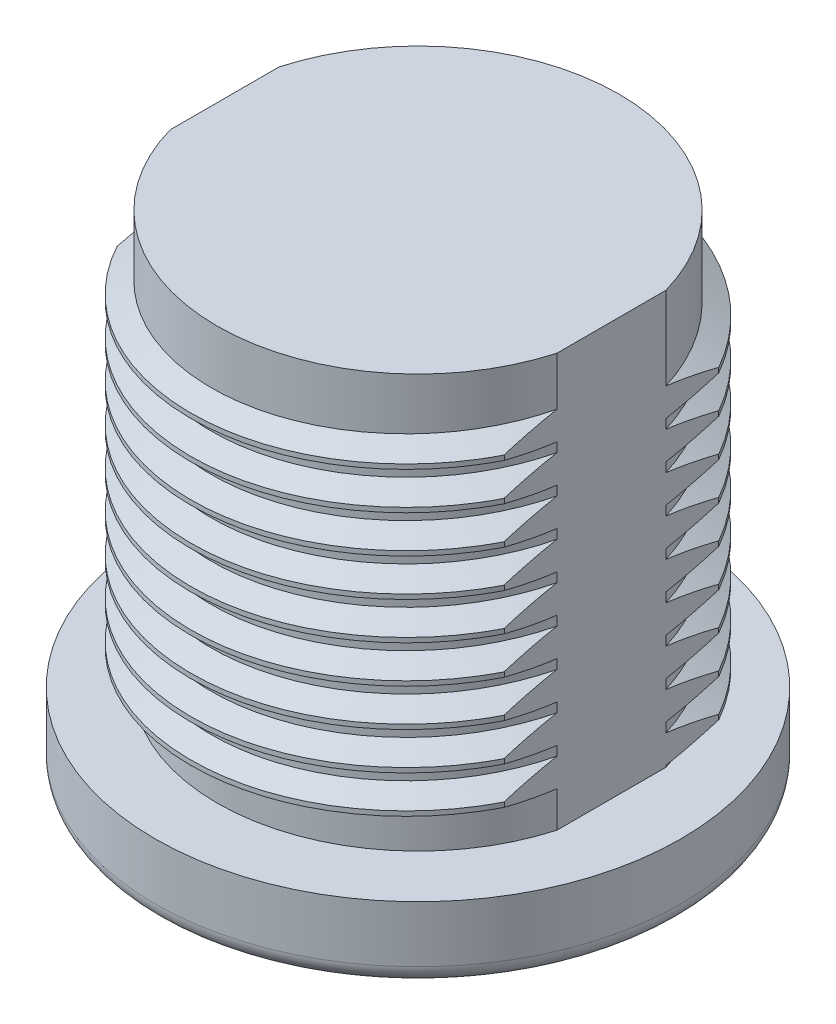
from build123d import *
from build123d.topology import SkipClean

# Parameters (mm, degrees)
CROQUIS1_R              = 7
SALIENTE_EXTRUIR1_DEPTH = 2
CROQUIS2_R              = 5.35
SALIENTE_EXTRUIR2_DEPTH = 11
ROSCA1_PITCH            = 1
CROQUIS6_W              = 1
CROQUIS6_H              = 5.7
CORTAR_EXTRUIR1_DEPTH   = 11
REDONDEO1_R             = 0.5
CROQUIS7_R              = 3.25
CORTAR_EXTRUIR2_DEPTH   = 8
CROQUIS8_R              = 0.5
SALIENTE_EXTRUIR3_DEPTH = 6
REDONDEO2_R             = 0.5


with BuildPart() as part:
    # Croquis1 → Saliente-Extruir1 (new body)
    with BuildSketch(Plane(origin=(0, 0, 0), x_dir=(1, 0, 0), z_dir=(0, 1, 0))):
        with Locations(Location((0, 0, 0), (0, 0, 270))):
            Circle(CROQUIS1_R)
    extrude(amount=SALIENTE_EXTRUIR1_DEPTH)

    # Croquis2 → Saliente-Extruir2 (add)
    with BuildSketch(Plane(origin=(0, 2, 0), x_dir=(1, 0, 0), z_dir=(0, 1, 0))):
        with Locations(Location((0, 0, 0), (0, 0, 270))):
            Circle(CROQUIS2_R)
    extrude(amount=SALIENTE_EXTRUIR2_DEPTH)

    # Rosca1: the profile of Perfil de rosca1 profile screwed along a right-hand helix of 9 turns, 8 arcs to a turn; built about Z, then put on its axis
    with SkipClean():  # the faces are left unmerged after this step: merging them gives an invalid solid
        rosca1_z = Axis((0, 0, 0), (0, 0, 1))
        rosca1_corners = [(5.3497, 0, -0.000173205), (5.891265875, 0, 0.312499999), (5.891265875, 0, 0.437499999), (5.3497, 0, 0.750173202)]
        with BuildLine(mode=Mode.PRIVATE) as rosca1_profile:
            Line(rosca1_corners[0], rosca1_corners[1])
            Line(rosca1_corners[1], rosca1_corners[2])
            Line(rosca1_corners[2], rosca1_corners[3])
            Line(rosca1_corners[3], rosca1_corners[0])
        rosca1_cap = Face(rosca1_profile.wire())
        rosca1_turn_angles = [0, 22.5, 45, 67.5, 90, 112.5, 135, 157.5, 180, 202.5, 225, 247.5, 270, 292.5, 315, 337.5, 360]
        rosca1_turn_weights = [1, 0.9238795325112867, 1, 0.9238795325112867, 1, 0.9238795325112867, 1, 0.9238795325112867, 1, 0.9238795325112867, 1, 0.9238795325112867, 1, 0.9238795325112867, 1, 0.9238795325112867, 1]
        rosca1_turn_rails = [Edge.make_bspline([Vector(p[0], p[1], 0).rotate(rosca1_z, rosca1_turn_angles[k]) / rosca1_turn_weights[k] + Vector(0, 0, p[2] + ROSCA1_PITCH * rosca1_turn_angles[k] / 360) for k in range(17)], [0, 0, 0, 1, 1, 2, 2, 3, 3, 4, 4, 5, 5, 6, 6, 7, 7, 8, 8, 8], 2, rosca1_turn_weights) for p in rosca1_corners]
        rosca1_turn_sides = [Face.make_surface_from_curves(rosca1_turn_rails[p[0]], rosca1_turn_rails[p[1]]) for p in [(0, 1), (1, 2), (2, 3), (3, 0)]]
        rosca1 = Plane(origin=(0, 2, 0), x_dir=(1, 0, 0), z_dir=(0, 1, 0)) * Solid(Shell([*[p.moved(Location((0, 0, ROSCA1_PITCH * i))) for i in range(9) for p in rosca1_turn_sides], rosca1_cap, rosca1_cap.rotate(rosca1_z, 3240).moved(Location((0, 0, ROSCA1_PITCH * 3240 / 360)))]))
        add(rosca1)

    # Croquis6 → Cortar-Extruir1 (cut)
    with BuildSketch(Plane(origin=(0, 13, 0), x_dir=(1, 0, 0), z_dir=(0, 1, 0))):
        with Locations((5.65, 0)):
            Rectangle(CROQUIS6_W, CROQUIS6_H)
        with Locations((-5.65, 0)):
            Rectangle(CROQUIS6_W, CROQUIS6_H)
    extrude(amount=-CORTAR_EXTRUIR1_DEPTH, mode=Mode.SUBTRACT)

    # Redondeo1
    redondeo1_edges = [part.edges().sort_by_distance(p)[0] for p in [
        (0, 0, -7),
    ]]
    fillet(redondeo1_edges, radius=REDONDEO1_R)

    # Croquis7 → Cortar-Extruir2 (cut)
    with BuildSketch(Plane.XZ):
        with Locations(Location((0, -1.25, 0), (0, 0, 270))):
            Circle(CROQUIS7_R)
    extrude(amount=-CORTAR_EXTRUIR2_DEPTH, mode=Mode.SUBTRACT)

    # Croquis8 → Saliente-Extruir3 (add)
    with BuildSketch(Plane.XZ.offset(-8)):
        with Locations(Location((0, -1.25, 0), (0, 0, 270))):
            Circle(CROQUIS8_R)
    extrude(amount=SALIENTE_EXTRUIR3_DEPTH)

    # Redondeo2
    redondeo2_edges = [part.edges().sort_by_distance(p)[0] for p in [
        (0, 2, -0.75),
    ]]
    fillet(redondeo2_edges, radius=REDONDEO2_R)


solid = part.part
